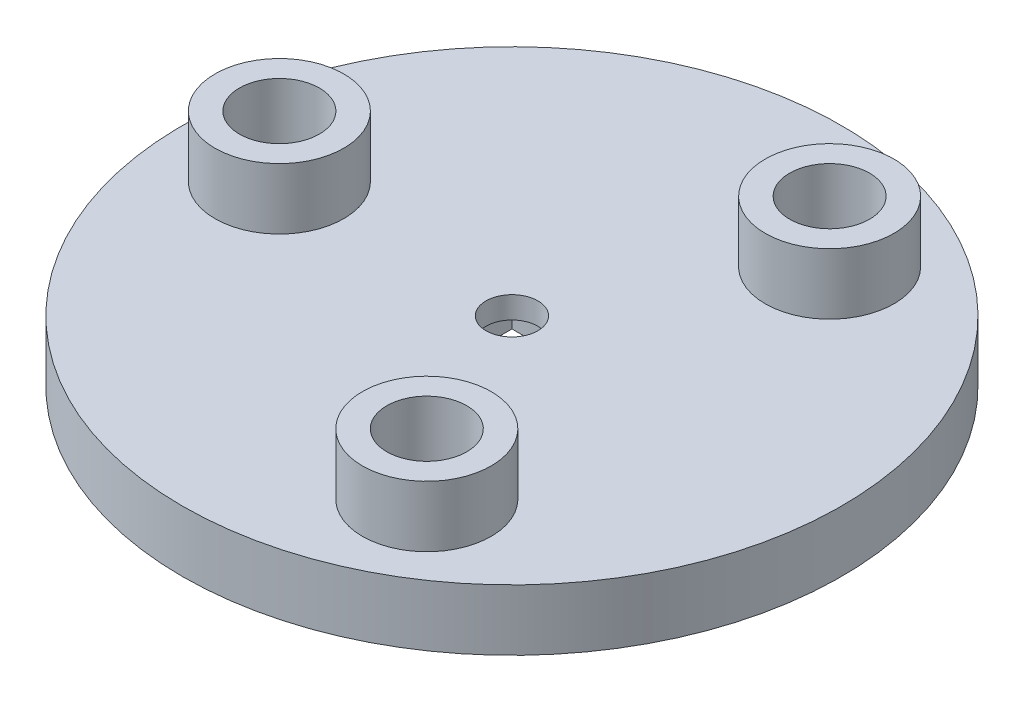
from build123d import *

# Parameters (mm, degrees)
SKETCH2_R           = 27
SKETCH2_R_2         = 2.125
BOSS_EXTRUDE2_DEPTH = 10
SKETCH3_R           = 3.275
CUT_EXTRUDE1_DEPTH  = 7.5
CUT_EXTRUDE2_START  = -5
SKETCH4_R           = 27
SKETCH4_R_2         = 5.275
CUT_EXTRUDE2_DEPTH  = 5
SKETCH5_W           = 8.128
SKETCH5_H           = 8.13
CUT_EXTRUDE3_DEPTH  = 3.2


with BuildPart() as part:
    # Sketch2 → Boss-Extrude2 (new body)
    with BuildSketch(Plane(origin=(0, 0, 0), x_dir=(1, 0, 0), z_dir=(0, 1, 0))):
        Circle(SKETCH2_R)
        Circle(SKETCH2_R_2, mode=Mode.SUBTRACT)
    extrude(amount=BOSS_EXTRUDE2_DEPTH)

    # Sketch3 → Cut-Extrude1 (cut)
    with BuildSketch(Plane.XZ.offset(-10)):
        with Locations((9.52625, -16.499949006)):
            Circle(SKETCH3_R)
        with Locations((9.52625, 16.499949006)):
            Circle(SKETCH3_R)
        with Locations((-19.0525, 0)):
            Circle(SKETCH3_R)
    extrude(amount=CUT_EXTRUDE1_DEPTH, mode=Mode.SUBTRACT)

    # Sketch4 → Cut-Extrude2 (cut)
    with BuildSketch(Plane(origin=(0, 10, 0), x_dir=(1, 0, 0), z_dir=(0, 1, 0)).offset(CUT_EXTRUDE2_START)):
        Circle(SKETCH4_R)
        with Locations((-19.0525, 0)):
            Circle(SKETCH4_R_2, mode=Mode.SUBTRACT)
        with Locations((9.52625, -16.499949006)):
            Circle(SKETCH4_R_2, mode=Mode.SUBTRACT)
        with Locations((9.52625, 16.499949006)):
            Circle(SKETCH4_R_2, mode=Mode.SUBTRACT)
    extrude(amount=CUT_EXTRUDE2_DEPTH, mode=Mode.SUBTRACT)

    # Sketch5 → Cut-Extrude3 (cut)
    with BuildSketch(Plane.XZ):
        Rectangle(SKETCH5_W, SKETCH5_H)
    extrude(amount=-CUT_EXTRUDE3_DEPTH, mode=Mode.SUBTRACT)


solid = part.part
